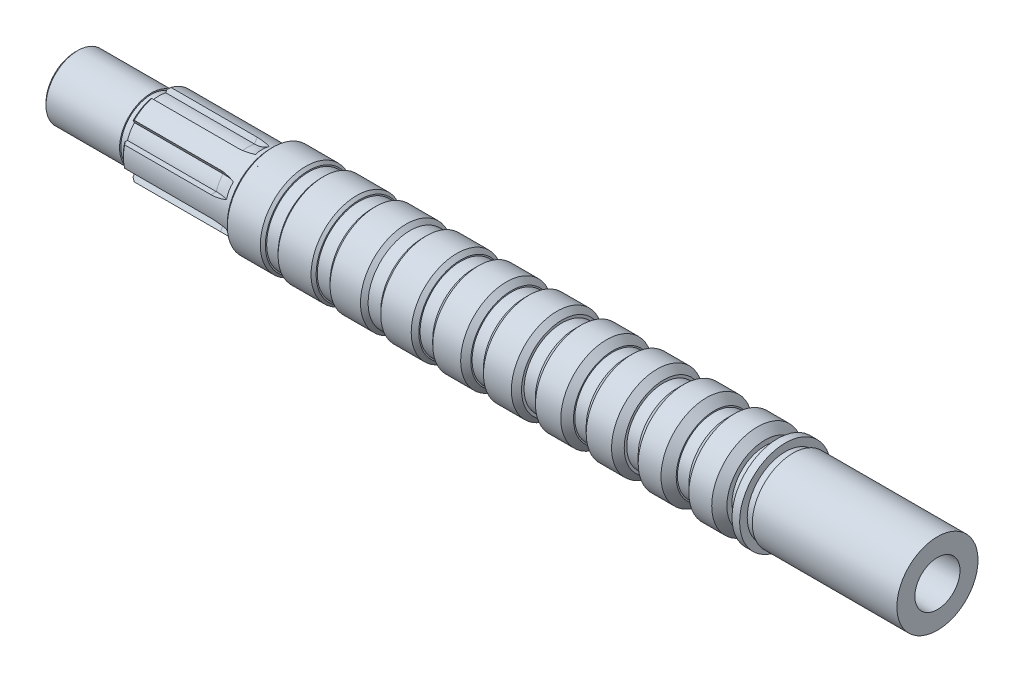
from build123d import *

# Parameters (mm, degrees)
SKETCH_1_R               = 12.5
EXTRUDE_1_DEPTH          = 340
SKETCH_3_R               = 16
EXTRUDE_2_DEPTH          = 60
SKETCH_4_OUTSIDE_W       = 102.6
SKETCH_4_OUTSIDE_H       = 102.6
SKETCH_4_OUTSIDE_R       = 15
CUT_EXTRUDE_1_DEPTH      = 3
SKETCH_5_R               = 18
EXTRUDE_3_DEPTH          = 3
SKETCH_6_R               = 18
EXTRUDE_4_DEPTH          = 15
PATTERN_LINEAR_1_COUNT   = 10
PATTERN_LINEAR_1_PITCH   = 20
EXTRUDE_5_REACH          = 251.303
SKETCH_7_R               = 16.5
EXTRUDE_6_REACH          = 231.417
SKETCH_8_R               = 16.5
EXTRUDE_7_REACH          = 211.552
SKETCH_9_R               = 16.5
EXTRUDE_8_REACH          = 191.716
SKETCH_10_R              = 16
EXTRUDE_9_REACH          = 175.874
SKETCH_11_R              = 15.5
EXTRUDE_10_REACH         = 195.68
SKETCH_12_R              = 15
EXTRUDE_11_REACH         = 215.523
SKETCH_13_R              = 15
EXTRUDE_12_REACH         = 235.392
SKETCH_14_R              = 14.5
EXTRUDE_13_REACH         = 255.282
SKETCH_15_R              = 14.5
EXTRUDE_14_REACH         = 275.189
SKETCH_16_R              = 13
EXTRUDE_START            = 44
SKETCH_17_R              = 15
EXTRUDE_15_DEPTH         = 44
CUT_EXTRUDE_START        = 3
SKETCH_18_R              = 12.5
SKETCH_18_R_2            = 12
CUT_EXTRUDE_2_DEPTH      = 3
CHAMFER_6_SIZE           = 1
PATTERN_CIRCULAR_1_COUNT = 6
SKETCH_22_R              = 6
CUT_EXTRUDE_3_DEPTH      = 341.95160947
CHAMFER_1_SIZE           = 1
CHAMFER_2_SIZE           = 1.5
CHAMFER_3_SIZE           = 2
CHAMFER_4_SIZE           = 2.5
CHAMFER_5_SIZE           = 3
SKETCH_26_R              = 8
CUT_EXTRUDE_6_DEPTH      = 10
CHAMFER_7_SIZE           = 1


with BuildPart() as part:
    # 草图1 → 凸台-拉伸1 (new body)
    with BuildSketch(Plane(origin=(0, 0, 0), x_dir=(0, 0, -1), z_dir=(1, 0, 0))):
        Circle(SKETCH_1_R)
    extrude(amount=EXTRUDE_1_DEPTH)

    # 草图3 → 凸台-拉伸2 (add)
    with BuildSketch(Plane(origin=(340, 0, 0), x_dir=(0, 0, -1), z_dir=(1, 0, 0))):
        Circle(SKETCH_3_R)
    extrude(amount=-EXTRUDE_2_DEPTH)

    # 草图4 outside → 切除-拉伸1 (cut)
    with BuildSketch(Plane.ZY.offset(-280)):
        Rectangle(SKETCH_4_OUTSIDE_W, SKETCH_4_OUTSIDE_H)
        Circle(SKETCH_4_OUTSIDE_R, mode=Mode.SUBTRACT)
    extrude(amount=-CUT_EXTRUDE_1_DEPTH, mode=Mode.SUBTRACT)

    # 草图5 → 凸台-拉伸3 (add)
    with BuildSketch(Plane.ZY.offset(-280)):
        Circle(SKETCH_5_R)
    extrude(amount=EXTRUDE_3_DEPTH)

    # 草图6 → 凸台-拉伸4 (add)
    with BuildSketch(Plane.ZY.offset(-272)):
        Circle(SKETCH_6_R)
    extrude_4 = extrude(amount=EXTRUDE_4_DEPTH)

    # 阵列(线性)1: 凸台-拉伸4 ×10
    with Locations(*[(-i * PATTERN_LINEAR_1_PITCH, 0, 0) for i in range(1, PATTERN_LINEAR_1_COUNT)]):
        add(extrude_4)

    # 草图7 → 凸台-拉伸5 (add, up to next)
    with BuildSketch(Plane(origin=(92, 0, 0), x_dir=(0, 0, -1), z_dir=(1, 0, 0)), mode=Mode.PRIVATE) as extrude_5_sk1:
        with Locations(Location((0, 0, 0), (0, 0, 180))):
            Circle(SKETCH_7_R)
    extrude_5_tool1 = extrude(extrude_5_sk1.sketch, amount=EXTRUDE_5_REACH, mode=Mode.PRIVATE) - part.part
    add(extrude_5_tool1.solids().sort_by_distance((92, 0, 0))[0])

    # 草图8 → 凸台-拉伸6 (add, up to next)
    with BuildSketch(Plane(origin=(112, 0, 0), x_dir=(0, 0, -1), z_dir=(1, 0, 0)), mode=Mode.PRIVATE) as extrude_6_sk1:
        with Locations(Location((0, 0, 0), (0, 0, 180))):
            Circle(SKETCH_8_R)
    extrude_6_tool1 = extrude(extrude_6_sk1.sketch, amount=EXTRUDE_6_REACH, mode=Mode.PRIVATE) - part.part
    add(extrude_6_tool1.solids().sort_by_distance((112, 0, 0))[0])

    # 草图9 → 凸台-拉伸7 (add, up to next)
    with BuildSketch(Plane(origin=(132, 0, 0), x_dir=(0, 0, -1), z_dir=(1, 0, 0)), mode=Mode.PRIVATE) as extrude_7_sk1:
        with Locations(Location((0, 0, 0), (0, 0, 180))):
            Circle(SKETCH_9_R)
    extrude_7_tool1 = extrude(extrude_7_sk1.sketch, amount=EXTRUDE_7_REACH, mode=Mode.PRIVATE) - part.part
    add(extrude_7_tool1.solids().sort_by_distance((132, 0, 0))[0])

    # 草图10 → 凸台-拉伸8 (add, up to next)
    with BuildSketch(Plane(origin=(152, 0, 0), x_dir=(0, 0, -1), z_dir=(1, 0, 0)), mode=Mode.PRIVATE) as extrude_8_sk1:
        Circle(SKETCH_10_R)
    extrude_8_tool1 = extrude(extrude_8_sk1.sketch, amount=EXTRUDE_8_REACH, mode=Mode.PRIVATE) - part.part
    add(extrude_8_tool1.solids().sort_by_distance((152, 0, 0))[0])

    # 草图11 → 凸台-拉伸9 (add, up to next)
    with BuildSketch(Plane(origin=(172, 0, 0), x_dir=(0, 0, -1), z_dir=(1, 0, 0)), mode=Mode.PRIVATE) as extrude_9_sk1:
        with Locations(Location((0, 0, 0), (0, 0, 180))):
            Circle(SKETCH_11_R)
    extrude_9_tool1 = extrude(extrude_9_sk1.sketch, amount=EXTRUDE_9_REACH, mode=Mode.PRIVATE) - part.part
    add(extrude_9_tool1.solids().sort_by_distance((172, 0, 0))[0])

    # 草图12 → 凸台-拉伸10 (add, up to next)
    with BuildSketch(Plane(origin=(192, 0, 0), x_dir=(0, 0, -1), z_dir=(1, 0, 0)), mode=Mode.PRIVATE) as extrude_10_sk1:
        with Locations(Location((0, 0, 0), (0, 0, 180))):
            Circle(SKETCH_12_R)
    extrude_10_tool1 = extrude(extrude_10_sk1.sketch, amount=EXTRUDE_10_REACH, mode=Mode.PRIVATE) - part.part
    add(extrude_10_tool1.solids().sort_by_distance((192, 0, 0))[0])

    # 草图13 → 凸台-拉伸11 (add, up to next)
    with BuildSketch(Plane(origin=(212, 0, 0), x_dir=(0, 0, -1), z_dir=(1, 0, 0)), mode=Mode.PRIVATE) as extrude_11_sk1:
        with Locations(Location((0, 0, 0), (0, 0, 180))):
            Circle(SKETCH_13_R)
    extrude_11_tool1 = extrude(extrude_11_sk1.sketch, amount=EXTRUDE_11_REACH, mode=Mode.PRIVATE) - part.part
    add(extrude_11_tool1.solids().sort_by_distance((212, 0, 0))[0])

    # 草图14 → 凸台-拉伸12 (add, up to next)
    with BuildSketch(Plane(origin=(232, 0, 0), x_dir=(0, 0, -1), z_dir=(1, 0, 0)), mode=Mode.PRIVATE) as extrude_12_sk1:
        with Locations(Location((0, 0, 0), (0, 0, 180))):
            Circle(SKETCH_14_R)
    extrude_12_tool1 = extrude(extrude_12_sk1.sketch, amount=EXTRUDE_12_REACH, mode=Mode.PRIVATE) - part.part
    add(extrude_12_tool1.solids().sort_by_distance((232, 0, 0))[0])

    # 草图15 → 凸台-拉伸13 (add, up to next)
    with BuildSketch(Plane(origin=(252, 0, 0), x_dir=(0, 0, -1), z_dir=(1, 0, 0)), mode=Mode.PRIVATE) as extrude_13_sk1:
        with Locations(Location((0, 0, 0), (0, 0, 180))):
            Circle(SKETCH_15_R)
    extrude_13_tool1 = extrude(extrude_13_sk1.sketch, amount=EXTRUDE_13_REACH, mode=Mode.PRIVATE) - part.part
    add(extrude_13_tool1.solids().sort_by_distance((252, 0, 0))[0])

    # 草图16 → 凸台-拉伸14 (add, up to next)
    with BuildSketch(Plane(origin=(272, 0, 0), x_dir=(0, 0, -1), z_dir=(1, 0, 0)), mode=Mode.PRIVATE) as extrude_14_sk1:
        with Locations(Location((0, 0, 0), (0, 0, 180))):
            Circle(SKETCH_16_R)
    extrude_14_tool1 = extrude(extrude_14_sk1.sketch, amount=EXTRUDE_14_REACH, mode=Mode.PRIVATE) - part.part
    add(extrude_14_tool1.solids().sort_by_distance((272, 0, 0))[0])

    # 草图17 → 凸台-拉伸15 (add)
    with BuildSketch(Plane.ZY.offset(-77).offset(EXTRUDE_START)):
        Circle(SKETCH_17_R)
    extrude(amount=-EXTRUDE_15_DEPTH)

    # 草图18 → 切除-拉伸2 (cut)
    with BuildSketch(Plane.ZY.offset(-33).offset(CUT_EXTRUDE_START)):
        Circle(SKETCH_18_R)
        Circle(SKETCH_18_R_2, mode=Mode.SUBTRACT)
    extrude(amount=-CUT_EXTRUDE_2_DEPTH, mode=Mode.SUBTRACT)

    # 倒角6
    chamfer_6_edges = [part.edges().sort_by_distance(p)[0] for p in [
        (0, 0, 12.5),
    ]]
    chamfer(chamfer_6_edges, length=CHAMFER_6_SIZE)

    # 切除-扫描1: sweep along a path in 草图20
    with BuildLine(Plane.XY) as sweep_1_path:
        Line((33, 13), (68, 13))
        ThreePointArc((68, 13), (72.644393001, 14.290939509), (75.956423686, 17.793419188))
    # 草图21 → 切除-扫描1 (sweep, cut)
    with BuildSketch(Plane.ZY.offset(-33)):
        with BuildLine():
            Line((-2.720556823, 12.712142643), (-3.764314532, 14.519984026))
            ThreePointArc((-3.764314532, 14.519984026), (0, 15), (3.764314532, 14.519984026))
            Line((3.764314532, 14.519984026), (2.720556823, 12.712142643))
            ThreePointArc((2.720556823, 12.712142643), (0, 13), (-2.720556823, 12.712142643))
        make_face()
    sweep_1 = sweep(path=sweep_1_path.line, mode=Mode.SUBTRACT)

    # 阵列(圆周)1: 切除-扫描1 ×6 about axis
    pattern_circular_1_axis = Axis((0, 0, 0), (1, 0, 0))
    for i in range(1, PATTERN_CIRCULAR_1_COUNT):
        add(sweep_1.rotate(pattern_circular_1_axis, i * 360 / PATTERN_CIRCULAR_1_COUNT), mode=Mode.SUBTRACT)

    # 草图22 → 切除-拉伸3 (cut, through all)
    with BuildSketch(Plane.ZY):
        Circle(SKETCH_22_R)
    extrude(amount=-CUT_EXTRUDE_3_DEPTH, mode=Mode.SUBTRACT)

    # 倒角1
    chamfer_1_edges = [part.edges().sort_by_distance(p)[0] for p in [
        (112, 0, -18),
        (97, 0, -18),
        (92, 0, -18),
        (77, 0, -18),
    ]]
    chamfer(chamfer_1_edges, length=CHAMFER_1_SIZE)

    # 倒角2
    chamfer_2_edges = [part.edges().sort_by_distance(p)[0] for p in [
        (152, 0, -18),
        (137, 0, -18),
        (132, 0, -18),
        (117, 0, -18),
    ]]
    chamfer(chamfer_2_edges, length=CHAMFER_2_SIZE - 0.0001)  # a hair under: the kernel refuses the full size

    # 倒角3
    chamfer_3_edges = [part.edges().sort_by_distance(p)[0] for p in [
        (192, 0, -18),
        (177, 0, -18),
        (172, 0, -18),
        (157, 0, -18),
    ]]
    chamfer(chamfer_3_edges, length=CHAMFER_3_SIZE - 0.0001)  # a hair under: the kernel refuses the full size

    # 倒角4
    chamfer_4_edges = [part.edges().sort_by_distance(p)[0] for p in [
        (232, 0, -18),
        (217, 0, -18),
        (212, 0, -18),
        (197, 0, -18),
    ]]
    chamfer(chamfer_4_edges, length=CHAMFER_4_SIZE)

    # 倒角5
    chamfer_5_edges = [part.edges().sort_by_distance(p)[0] for p in [
        (272, 0, -18),
        (257, 0, -18),
        (252, 0, -18),
        (237, 0, -18),
    ]]
    chamfer(chamfer_5_edges, length=CHAMFER_5_SIZE)

    # 草图25 → 切除-旋转1 (revolve, cut)
    with BuildSketch(Plane(origin=(0, 0, 0), x_dir=(1, 0, 0), z_dir=(0, 1, 0)), mode=Mode.PRIVATE) as cut_revolve_1_sk:
        Polygon((340, 0), (340, 8.89), (280, 7.391498501), (280, 0), align=None)
    revolve(cut_revolve_1_sk.sketch.rotate(Axis((340, 0, 0), (-1, 0, 0)), 180), axis=Axis((340, 0, 0), (-1, 0, 0)), mode=Mode.SUBTRACT)

    # 草图26 → 切除-拉伸6 (cut)
    with BuildSketch(Plane(origin=(280, 0, 0), x_dir=(0, 0, -1), z_dir=(1, 0, 0))):
        Circle(SKETCH_26_R)
    extrude(amount=-CUT_EXTRUDE_6_DEPTH, mode=Mode.SUBTRACT)

    # 倒角7
    chamfer_7_edges = [part.edges().sort_by_distance(p)[0] for p in [
        (33, 12.990381057, -7.5),
        (33, 12.990381057, 7.5),
        (33, -2.018355219, 14.863587797),
        (33, -12.990381057, 7.5),
        (33, -12.990381057, -7.5),
        (33, 0, -15),
    ]]
    chamfer(chamfer_7_edges, length=CHAMFER_7_SIZE)


solid = part.part
